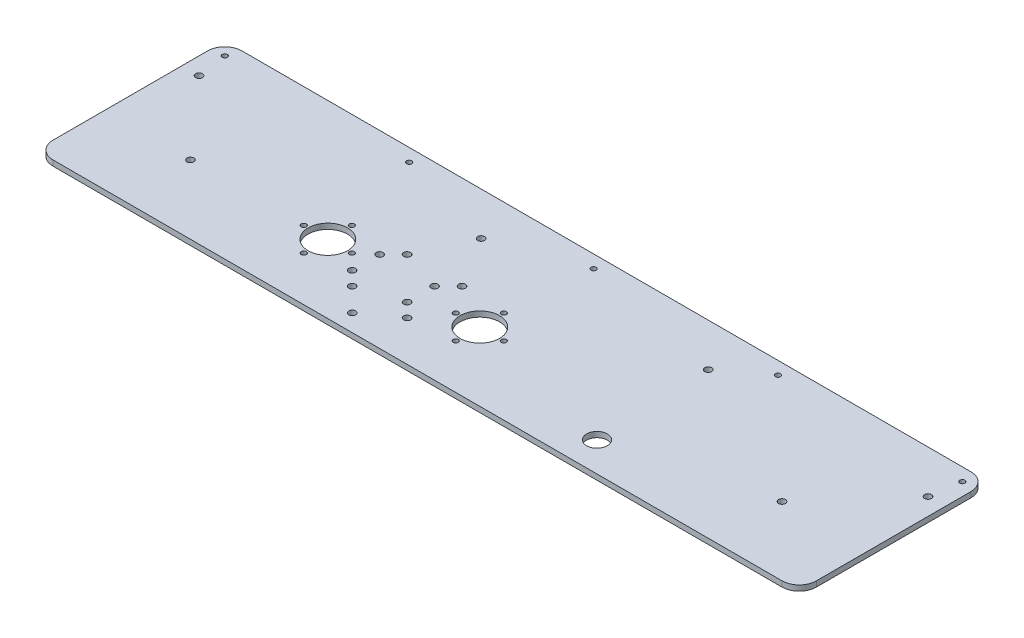
from build123d import *

# Parameters (mm, degrees)
SKETCH1_R           = 2
SKETCH1_R_2         = 1.5
SKETCH1_R_3         = 6
SKETCH1_R_4         = 11.5
BOSS_EXTRUDE1_DEPTH = 3.175
FILLET1_R           = 10
SKETCH2_R           = 2
CUT_EXTRUDE1_DEPTH  = 10


with BuildPart() as part:
    # Sketch1 → Boss-Extrude1 (new body)
    with BuildSketch(Plane(origin=(0, 0, 0), x_dir=(1, 0, 0), z_dir=(0, 1, 0))):
        Polygon((-26.799577535, 0), (417.700422465, 0), (417.700422465, 17.22815868), (417.700422465, 110), (-26.799577535, 110), align=None)
        with Locations((23.200422465, 40)):
            Circle(SKETCH1_R, mode=Mode.SUBTRACT)
        with Locations((89.200422465, 40)):
            Circle(SKETCH1_R_2, mode=Mode.SUBTRACT)
        with Locations((103.200422465, 26)):
            Circle(SKETCH1_R_2, mode=Mode.SUBTRACT)
        with Locations((117.200422465, 40)):
            Circle(SKETCH1_R_2, mode=Mode.SUBTRACT)
        with Locations((177.700422465, 40)):
            Circle(SKETCH1_R_2, mode=Mode.SUBTRACT)
        with Locations((191.700422465, 26)):
            Circle(SKETCH1_R_2, mode=Mode.SUBTRACT)
        with Locations((205.700422465, 40)):
            Circle(SKETCH1_R_2, mode=Mode.SUBTRACT)
        with Locations((367.700422465, 40)):
            Circle(SKETCH1_R, mode=Mode.SUBTRACT)
        with Locations((147.450422465, 10)):
            Circle(SKETCH1_R, mode=Mode.SUBTRACT)
        with Locations((282.700422465, 17.22815868)):
            Circle(SKETCH1_R_3, mode=Mode.SUBTRACT)
        with Locations((-16.799577535, 85)):
            Circle(SKETCH1_R, mode=Mode.SUBTRACT)
        with Locations((147.450422465, 85)):
            Circle(SKETCH1_R, mode=Mode.SUBTRACT)
        with Locations((103.200422465, 54)):
            Circle(SKETCH1_R_2, mode=Mode.SUBTRACT)
        with Locations((103.200422465, 40)):
            Circle(SKETCH1_R_4, mode=Mode.SUBTRACT)
        with Locations((279.700422465, 85)):
            Circle(SKETCH1_R, mode=Mode.SUBTRACT)
        with Locations((191.700422465, 54)):
            Circle(SKETCH1_R_2, mode=Mode.SUBTRACT)
        with Locations((191.700422465, 40)):
            Circle(SKETCH1_R_4, mode=Mode.SUBTRACT)
        with Locations((407.700422465, 85)):
            Circle(SKETCH1_R, mode=Mode.SUBTRACT)
        with Locations((-19.299577535, 102.5)):
            Circle(SKETCH1_R_2, mode=Mode.SUBTRACT)
        with Locations((88.075422465, 102.5)):
            Circle(SKETCH1_R_2, mode=Mode.SUBTRACT)
        with Locations((195.450422465, 102.5)):
            Circle(SKETCH1_R_2, mode=Mode.SUBTRACT)
        with Locations((302.825422465, 102.5)):
            Circle(SKETCH1_R_2, mode=Mode.SUBTRACT)
        with Locations((410.200422465, 102.5)):
            Circle(SKETCH1_R_2, mode=Mode.SUBTRACT)
    extrude(amount=BOSS_EXTRUDE1_DEPTH)

    # Fillet1
    fillet1_edges = [part.edges().sort_by_distance(p)[0] for p in [
        (417.700422465, 1.5875, -110),
        (417.700422465, 1.5875, 0),
        (-26.799577535, 1.5875, 0),
        (-26.799577535, 1.5875, -110),
    ]]
    fillet(fillet1_edges, radius=FILLET1_R)

    # Sketch2 → Cut-Extrude1 (cut)
    with BuildSketch(Plane(origin=(0, 3.175, 0), x_dir=(1, 0, 0), z_dir=(0, 1, 0))):
        with Locations((133.950422465, 55.40559892)):
            Circle(SKETCH2_R)
        with Locations((165.950422465, 55.40559892)):
            Circle(SKETCH2_R)
        with Locations((133.950422465, 23.40559892)):
            Circle(SKETCH2_R)
        with Locations((165.950422465, 23.40559892)):
            Circle(SKETCH2_R)
        with Locations((157.950422465, 31.40559892)):
            Circle(SKETCH2_R)
        with Locations((125.950422465, 31.40559892)):
            Circle(SKETCH2_R)
        with Locations((125.950422465, 47.40559892)):
            Circle(SKETCH2_R)
        with Locations((157.950422465, 47.40559892)):
            Circle(SKETCH2_R)
    extrude(amount=-CUT_EXTRUDE1_DEPTH, mode=Mode.SUBTRACT)


solid = part.part
